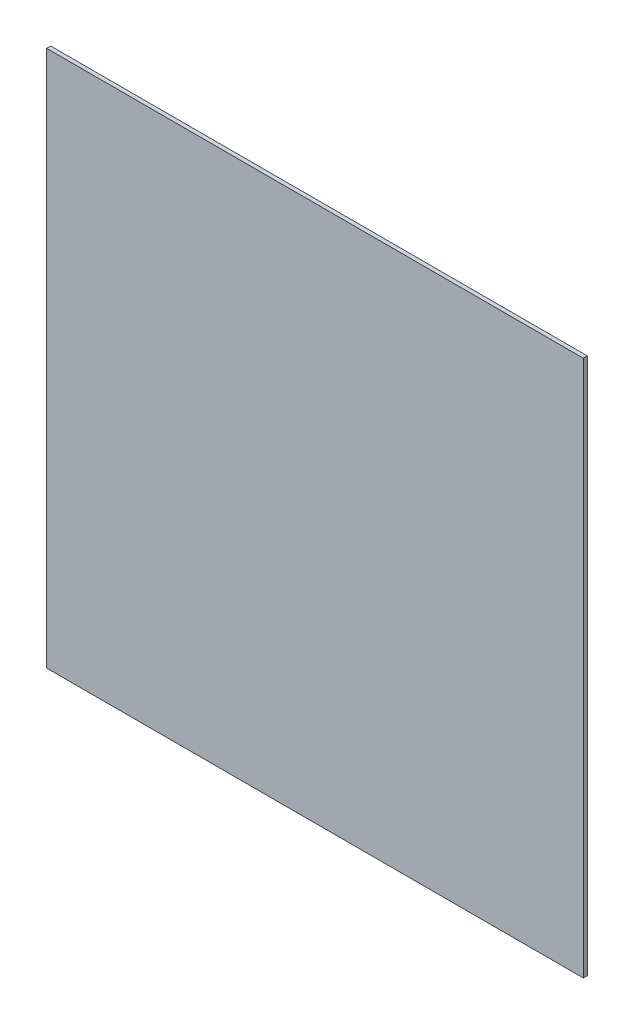
from build123d import *

# Parameters (mm, degrees)
IZIM1_W            = 2000
IZIM1_H            = 2000
TABAN_FLAN_1_DEPTH = 15


# Sheet-metal steps are written as plain solids
with BuildPart() as part:
    # Çizim1 → Taban-Flanş1 (new body)
    with BuildSketch(Plane.XY):
        with Locations((1000, -1000)):
            Rectangle(IZIM1_W, IZIM1_H)
    extrude(amount=-TABAN_FLAN_1_DEPTH)


solid = part.part
